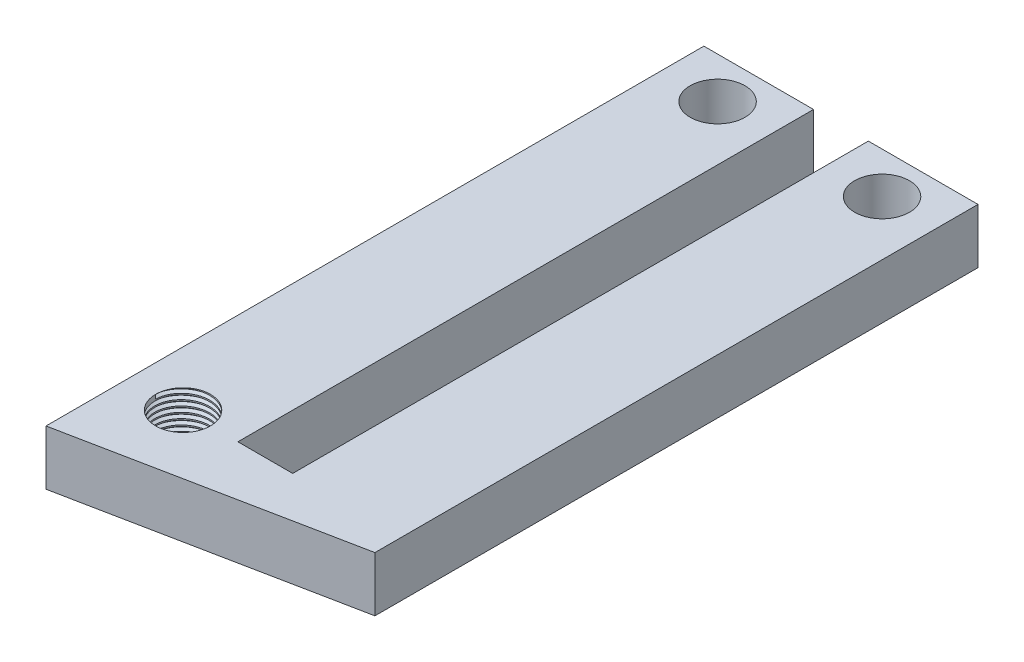
from build123d import *

# Parameters (mm, degrees)
SKETCH1_W             = 25.4
SKETCH1_H             = 12.7
BOSS_EXTRUDE1_DEPTH   = 152.4
BOSS_EXTRUDE1_2_DEPTH = 152.4
SKETCH2_W             = 19.05
SKETCH2_H             = 12.7
BOSS_EXTRUDE2_DEPTH   = 12.7
SKETCH3_R             = 6.35
CUT_EXTRUDE1_DEPTH    = 166.587741092
CUT_EXTRUDE4_DEPTH    = 12.7
SKETCH5_R             = 6.35
CUT_EXTRUDE5_DEPTH    = 12.7
THREAD1_PITCH         = 1.27


with BuildPart() as part:
    # Sketch1 → Boss-Extrude1 (new body)
    with BuildSketch(Plane.XY):
        with Locations((12.7, 6.35)):
            Rectangle(SKETCH1_W, SKETCH1_H)
    extrude(amount=BOSS_EXTRUDE1_DEPTH)



with BuildPart() as body_2:
    # Sketch1 → Boss-Extrude1 2 (new body)
    with BuildSketch(Plane.XY):
        with Locations((50.8, 6.35)):
            Rectangle(SKETCH1_W, SKETCH1_H)
    extrude(amount=BOSS_EXTRUDE1_2_DEPTH)


with BuildPart() as part_1:
    add(part.part)

    add(body_2.part)  # Boss-Extrude2 merges body 2
    # Sketch2 → Boss-Extrude2 (add)
    with BuildSketch(Plane(origin=(25.4, 0, 0), x_dir=(0, 0, -1), z_dir=(1, 0, 0))):
        with Locations((-142.875, 6.35)):
            Rectangle(SKETCH2_W, SKETCH2_H)
    extrude(amount=BOSS_EXTRUDE2_DEPTH)

    # Sketch3 → Cut-Extrude1 (cut, through all)
    with BuildSketch(Plane(origin=(0, 12.7, 0), x_dir=(1, 0, 0), z_dir=(0, 1, 0))):
        with Locations(Location((12.7, -9.525, 0), (0, 0, 270))):
            Circle(SKETCH3_R)
        with Locations(Location((50.8, -9.525, 0), (0, 0, 270))):
            Circle(SKETCH3_R)
    extrude(amount=-CUT_EXTRUDE1_DEPTH, mode=Mode.SUBTRACT)

    # Sketch4 → Cut-Extrude4 (cut)
    with BuildSketch(Plane(origin=(0, 12.7, 0), x_dir=(1, 0, 0), z_dir=(0, 1, 0))):
        Polygon((0, -152.4), (63.5, -139.7), (63.5, -152.4), align=None)
    extrude(amount=-CUT_EXTRUDE4_DEPTH, mode=Mode.SUBTRACT)

    # Sketch5 → Cut-Extrude5 (cut)
    with BuildSketch(Plane(origin=(0, 12.7, 0), x_dir=(1, 0, 0), z_dir=(0, 1, 0))):
        with Locations(Location((12.7, -133.35, 0), (0, 0, 270))):
            Circle(SKETCH5_R)
    extrude(amount=-CUT_EXTRUDE5_DEPTH, mode=Mode.SUBTRACT)

    # Thread1: the profile of Thread Profile1 profile screwed along a right-hand helix of 10 turns, 8 arcs to a turn; built about Z, then put on its axis
    thread1_z = Axis((0, 0, 0), (0, 0, 1))
    thread1_corners = [(6.3497, 0, -0.000173205), (7.037407661, 0, 0.396874998), (7.037407661, 0, 0.555624998), (6.3497, 0, 0.952673202)]
    with BuildLine(mode=Mode.PRIVATE) as thread1_profile:
        Line(thread1_corners[0], thread1_corners[1])
        Line(thread1_corners[1], thread1_corners[2])
        Line(thread1_corners[2], thread1_corners[3])
        Line(thread1_corners[3], thread1_corners[0])
    thread1_cap = Face(thread1_profile.wire())
    thread1_turn_angles = [0, 22.5, 45, 67.5, 90, 112.5, 135, 157.5, 180, 202.5, 225, 247.5, 270, 292.5, 315, 337.5, 360]
    thread1_turn_weights = [1, 0.9238795325112867, 1, 0.9238795325112867, 1, 0.9238795325112867, 1, 0.9238795325112867, 1, 0.9238795325112867, 1, 0.9238795325112867, 1, 0.9238795325112867, 1, 0.9238795325112867, 1]
    thread1_turn_rails = [Edge.make_bspline([Vector(p[0], p[1], 0).rotate(thread1_z, thread1_turn_angles[k]) / thread1_turn_weights[k] + Vector(0, 0, p[2] + THREAD1_PITCH * thread1_turn_angles[k] / 360) for k in range(17)], [0, 0, 0, 1, 1, 2, 2, 3, 3, 4, 4, 5, 5, 6, 6, 7, 7, 8, 8, 8], 2, thread1_turn_weights) for p in thread1_corners]
    thread1_turn_sides = [Face.make_surface_from_curves(thread1_turn_rails[p[0]], thread1_turn_rails[p[1]]) for p in [(0, 1), (1, 2), (2, 3), (3, 0)]]
    thread1 = Plane(origin=(12.7, 12.7, 133.35), x_dir=(-1, 0, 0), z_dir=(0, -1, 0)) * Solid(Shell([*[p.moved(Location((0, 0, THREAD1_PITCH * i))) for i in range(10) for p in thread1_turn_sides], thread1_cap, thread1_cap.rotate(thread1_z, 3600).moved(Location((0, 0, THREAD1_PITCH * 3600 / 360)))]))
    add(thread1, mode=Mode.SUBTRACT)


solid = part_1.part
